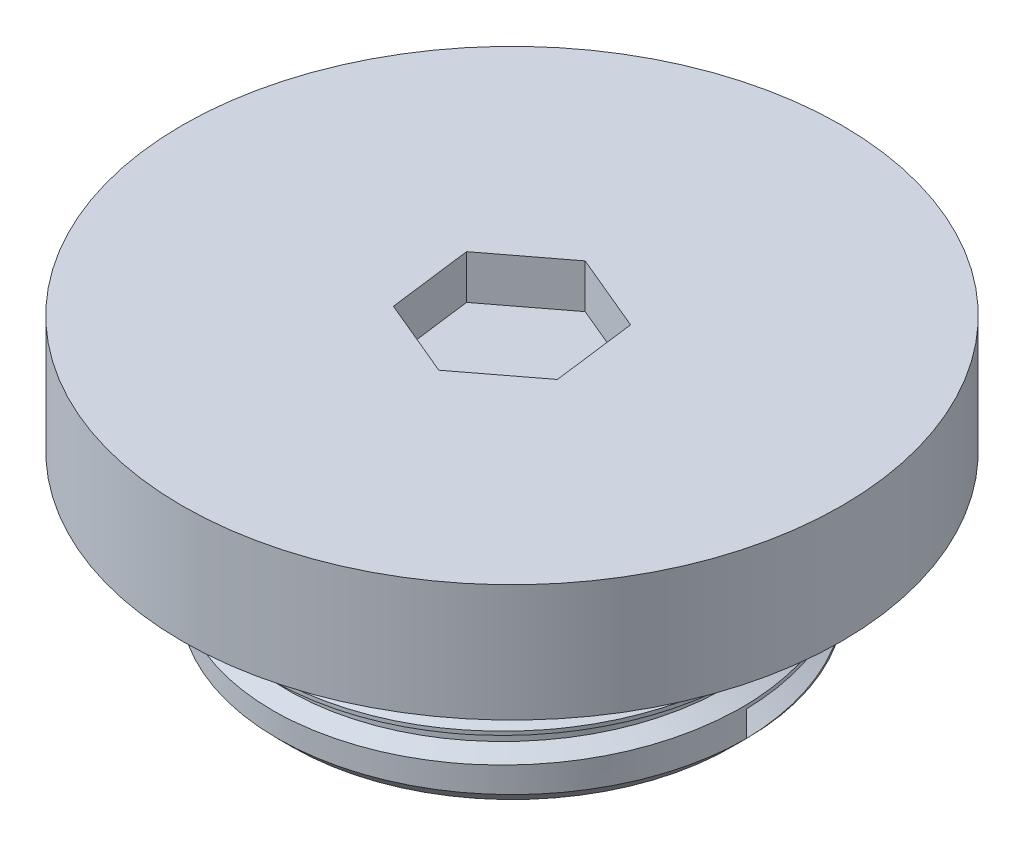
from build123d import *
from build123d.topology import SkipClean

# Parameters (mm, degrees)
SKETCH1_R           = 16
BOSS_EXTRUDE1_DEPTH = 10
SKETCH2_R           = 22.5
BOSS_EXTRUDE2_DEPTH = 8
CHAMFER1_SIZE       = 1
SKETCH3_R           = 10
CUT_EXTRUDE1_DEPTH  = 10
CUT_EXTRUDE2_DEPTH  = 3
CHAMFER2_SIZE       = 1
THREAD1_PITCH       = 2


with BuildPart() as part:
    # Sketch1 → Boss-Extrude1 (new body)
    with BuildSketch(Plane(origin=(0, 0, 0), x_dir=(1, 0, 0), z_dir=(0, 1, 0))):
        with Locations(Location((0, 0, 0), (0, 0, 270))):
            Circle(SKETCH1_R)
    extrude(amount=BOSS_EXTRUDE1_DEPTH)

    # Sketch2 → Boss-Extrude2 (add)
    with BuildSketch(Plane(origin=(0, 10, 0), x_dir=(1, 0, 0), z_dir=(0, 1, 0))):
        with Locations(Location((0, 0, 0), (0, 0, 270))):
            Circle(SKETCH2_R)
    extrude(amount=BOSS_EXTRUDE2_DEPTH)

    # Chamfer1
    chamfer1_edges = [part.edges().sort_by_distance(p)[0] for p in [
        (0, 0, -16),
    ]]
    chamfer(chamfer1_edges, length=CHAMFER1_SIZE)

    # Sketch3 → Cut-Extrude1 (cut)
    with BuildSketch(Plane.XZ):
        with Locations(Location((0, 0, 0), (0, 0, 270))):
            Circle(SKETCH3_R)
    extrude(amount=-CUT_EXTRUDE1_DEPTH, mode=Mode.SUBTRACT)

    # Sketch4 → Cut-Extrude2 (cut)
    with BuildSketch(Plane(origin=(0, 18, 0), x_dir=(1, 0, 0), z_dir=(0, 1, 0))):
        Polygon((5.326189108, -2.228237625), (4.592804943, 3.49849626), (-0.733384165, 5.726733886), (-5.326189108, 2.228237625), (-4.592804943, -3.49849626), (0.733384165, -5.726733886), align=None)
    extrude(amount=-CUT_EXTRUDE2_DEPTH, mode=Mode.SUBTRACT)

    # Chamfer2
    chamfer2_edges = [part.edges().sort_by_distance(p)[0] for p in [
        (0, 0, 10),
    ]]
    chamfer(chamfer2_edges, length=CHAMFER2_SIZE)

    # Thread1: the profile of Thread Profile1 profile screwed along a right-hand helix of 4.5 turns, 10 arcs to a turn; built about Z, then put on its axis
    with SkipClean():  # the faces are left unmerged after this step: merging them gives an invalid solid
        thread1_z = Axis((0, 0, 0), (0, 0, 1))
        thread1_corners = [(16.0003, 0, -0.000173205), (16.0003, 0, 1.7501732), (14.91746825, 0, 1.124999997), (14.91746825, 0, 0.624999997)]
        with BuildLine(mode=Mode.PRIVATE) as thread1_profile:
            Line(thread1_corners[0], thread1_corners[1])
            Line(thread1_corners[1], thread1_corners[2])
            Line(thread1_corners[2], thread1_corners[3])
            Line(thread1_corners[3], thread1_corners[0])
        thread1_cap = Face(thread1_profile.wire())
        thread1_turn_angles = [0, 18, 36, 54, 72, 90, 108, 126, 144, 162, 180, 198, 216, 234, 252, 270, 288, 306, 324, 342, 360]
        thread1_turn_weights = [1, 0.9510565162951535, 1, 0.9510565162951535, 1, 0.9510565162951535, 1, 0.9510565162951535, 1, 0.9510565162951535, 1, 0.9510565162951535, 1, 0.9510565162951535, 1, 0.9510565162951535, 1, 0.9510565162951535, 1, 0.9510565162951535, 1]
        thread1_turn_rails = [Edge.make_bspline([Vector(p[0], p[1], 0).rotate(thread1_z, thread1_turn_angles[k]) / thread1_turn_weights[k] + Vector(0, 0, p[2] + THREAD1_PITCH * thread1_turn_angles[k] / 360) for k in range(21)], [0, 0, 0, 1, 1, 2, 2, 3, 3, 4, 4, 5, 5, 6, 6, 7, 7, 8, 8, 9, 9, 10, 10, 10], 2, thread1_turn_weights) for p in thread1_corners]
        thread1_turn_sides = [Face.make_surface_from_curves(thread1_turn_rails[p[0]], thread1_turn_rails[p[1]]) for p in [(0, 1), (1, 2), (2, 3), (3, 0)]]
        thread1_last_angles = [1440, 1458, 1476, 1494, 1512, 1530, 1548, 1566, 1584, 1602, 1620]
        thread1_last_weights = [1, 0.9510565162951535, 1, 0.9510565162951535, 1, 0.9510565162951535, 1, 0.9510565162951535, 1, 0.9510565162951535, 1]
        thread1_last_rails = [Edge.make_bspline([Vector(p[0], p[1], 0).rotate(thread1_z, thread1_last_angles[k]) / thread1_last_weights[k] + Vector(0, 0, p[2] + THREAD1_PITCH * thread1_last_angles[k] / 360) for k in range(11)], [0, 0, 0, 1, 1, 2, 2, 3, 3, 4, 4, 5, 5, 5], 2, thread1_last_weights) for p in thread1_corners]
        thread1_last_sides = [Face.make_surface_from_curves(thread1_last_rails[p[0]], thread1_last_rails[p[1]]) for p in [(0, 1), (1, 2), (2, 3), (3, 0)]]
        thread1 = Plane(origin=(0, 1, 0), x_dir=(1, 0, 0), z_dir=(0, 1, 0)) * Solid(Shell([*[p.moved(Location((0, 0, THREAD1_PITCH * i))) for i in range(4) for p in thread1_turn_sides], *thread1_last_sides, thread1_cap, thread1_cap.rotate(thread1_z, 1620).moved(Location((0, 0, THREAD1_PITCH * 1620 / 360)))]))
        add(thread1, mode=Mode.SUBTRACT)


solid = part.part
